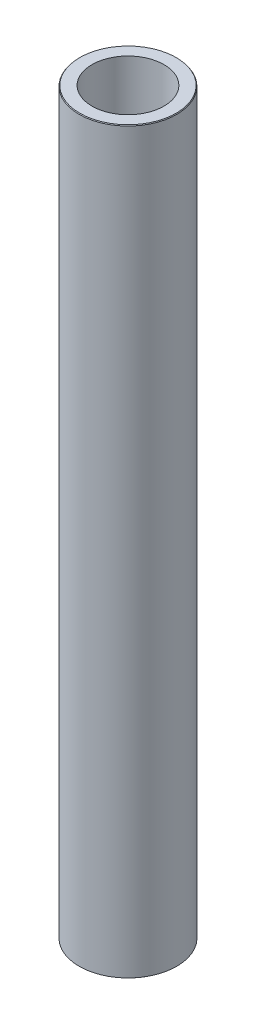
from build123d import *
from OCP.BRepFilletAPI import BRepFilletAPI_MakeChamfer

# Parameters (mm, degrees)
SKETCH1_R           = 27.5
BOSS_EXTRUDE1_DEPTH = 416.626312624
SKETCH2_R           = 20.293716325
CUT_EXTRUDE1_DEPTH  = 419.437551339
CHAMFER1_SIZE       = 0.433912887
CHAMFER1_SIZE2      = 0.319787584


with BuildPart() as part:
    # Sketch1 → Boss-Extrude1 (new body)
    with BuildSketch(Plane(origin=(0, 0, 0), x_dir=(1, 0, 0), z_dir=(0, 1, 0))):
        Circle(SKETCH1_R)
    extrude(amount=BOSS_EXTRUDE1_DEPTH)

    # Sketch2 → Cut-Extrude1 (cut, through all)
    with BuildSketch(Plane(origin=(0, 0, 0), x_dir=(1, 0, 0), z_dir=(0, 1, 0))):
        Circle(SKETCH2_R)
    extrude(amount=CUT_EXTRUDE1_DEPTH, mode=Mode.SUBTRACT)

    # Chamfer1: one chamfer whose edges measure the first distance from different faces: ONE call of the kernel's chamfer builder (chamfer() names one face for all edges)
    chamfer1_edges_1 = [part.edges().sort_by_distance(p)[0] for p in [
        (-27.5, 416.626312624, 0),
    ]]
    chamfer1_side_1 = [part.faces().sort_by_distance(p)[0] for p in [
        (-27.5, 208.313156312, 0),
    ]]
    chamfer1_edges_2 = [part.edges().sort_by_distance(p)[0] for p in [
        (-27.5, 0, 0),
    ]]
    chamfer1_side_2 = [part.faces().sort_by_distance(p)[0] for p in [
        (-26.722182541, 0, 0),
    ]]
    chamfer1 = BRepFilletAPI_MakeChamfer(part.part.solid().wrapped)
    for e in chamfer1_edges_1:
        chamfer1.Add(CHAMFER1_SIZE, CHAMFER1_SIZE2, e.wrapped, chamfer1_side_1[0].wrapped)  # the first distance lies on this face
    for e in chamfer1_edges_2:
        chamfer1.Add(CHAMFER1_SIZE, CHAMFER1_SIZE2, e.wrapped, chamfer1_side_2[0].wrapped)  # the first distance lies on this face
    add(Compound.cast(chamfer1.Shape()), mode=Mode.REPLACE)


solid = part.part
